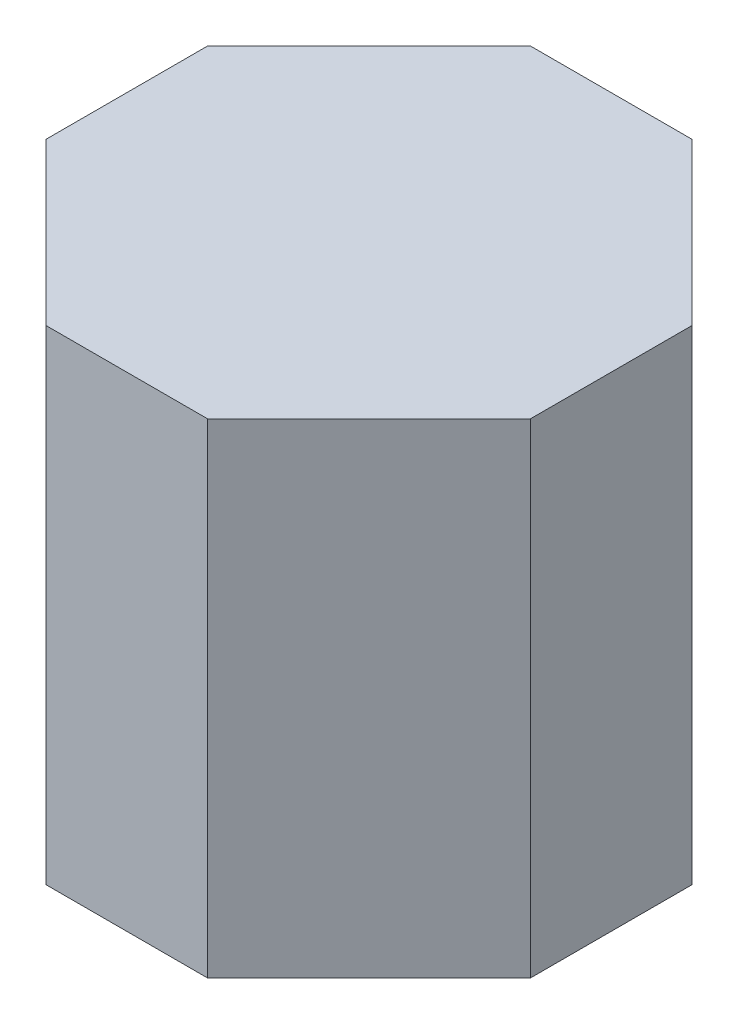
from build123d import *

# Parameters (mm, degrees)
ESQUISSE1_W             = 30
ESQUISSE1_H             = 30
BOSS_EXTRU_1_DEPTH      = 30
ENL_V_MAT_EXTRU_1_REACH = 47
ENL_V_MAT_EXTRU_2_REACH = 41.843
ESQUISSE4_R             = 3.25
ESQUISSE6_R             = 2.75
ENL_V_MAT_EXTRU_3_DEPTH = 10


with BuildPart() as part:
    # Esquisse1 → Boss.-Extru.1 (new body)
    with BuildSketch(Plane.XY):
        Rectangle(ESQUISSE1_W, ESQUISSE1_H)
    extrude(amount=BOSS_EXTRU_1_DEPTH)

    # Esquisse3 → Enlèv. mat.-Extru.1 (cut, up to next)
    with BuildSketch(Plane(origin=(0, 15, 0), x_dir=(1, 0, 0), z_dir=(0, 1, 0)), mode=Mode.PRIVATE) as enl_v_mat_extru_1_sk1:
        Polygon((-15, -20), (-5, -30), (-15, -30), align=None)
    enl_v_mat_extru_1_tool1 = extrude(enl_v_mat_extru_1_sk1.sketch, amount=-ENL_V_MAT_EXTRU_1_REACH, mode=Mode.PRIVATE) & part.part
    # Esquisse3 → Enlèv. mat.-Extru.1 (cut, up to next)
    with BuildSketch(Plane(origin=(0, 15, 0), x_dir=(1, 0, 0), z_dir=(0, 1, 0)), mode=Mode.PRIVATE) as enl_v_mat_extru_1_sk2:
        Polygon((-15, 0), (-15, -10), (-5, 0), align=None)
    enl_v_mat_extru_1_tool2 = extrude(enl_v_mat_extru_1_sk2.sketch, amount=-ENL_V_MAT_EXTRU_1_REACH, mode=Mode.PRIVATE) & part.part
    # Esquisse3 → Enlèv. mat.-Extru.1 (cut, up to next)
    with BuildSketch(Plane(origin=(0, 15, 0), x_dir=(1, 0, 0), z_dir=(0, 1, 0)), mode=Mode.PRIVATE) as enl_v_mat_extru_1_sk3:
        Polygon((15, 0), (5, 0), (15, -10), align=None)
    enl_v_mat_extru_1_tool3 = extrude(enl_v_mat_extru_1_sk3.sketch, amount=-ENL_V_MAT_EXTRU_1_REACH, mode=Mode.PRIVATE) & part.part
    # Esquisse3 → Enlèv. mat.-Extru.1 (cut, up to next)
    with BuildSketch(Plane(origin=(0, 15, 0), x_dir=(1, 0, 0), z_dir=(0, 1, 0)), mode=Mode.PRIVATE) as enl_v_mat_extru_1_sk4:
        Polygon((15, -30), (15, -20), (5, -30), align=None)
    enl_v_mat_extru_1_tool4 = extrude(enl_v_mat_extru_1_sk4.sketch, amount=-ENL_V_MAT_EXTRU_1_REACH, mode=Mode.PRIVATE) & part.part
    add(enl_v_mat_extru_1_tool1.solids().sort_by_distance((-11.666667, 15, 26.666667))[0], mode=Mode.SUBTRACT)
    add(enl_v_mat_extru_1_tool2.solids().sort_by_distance((-11.666667, 15, 3.333333))[0], mode=Mode.SUBTRACT)
    add(enl_v_mat_extru_1_tool3.solids().sort_by_distance((11.666667, 15, 3.333333))[0], mode=Mode.SUBTRACT)
    add(enl_v_mat_extru_1_tool4.solids().sort_by_distance((11.666667, 15, 26.666667))[0], mode=Mode.SUBTRACT)

    # Esquisse4 → Enlèv. mat.-Extru.2 (cut, up to next)
    with BuildSketch(Plane(origin=(-17.5, 0, 17.5), x_dir=(0.7071067811865489, 0, 0.7071067811865462), z_dir=(-0.7071067811865462, 0, 0.7071067811865489)), mode=Mode.PRIVATE) as enl_v_mat_extru_2_sk1:
        with Locations((10.605533906, -5)):
            Circle(ESQUISSE4_R)
    enl_v_mat_extru_2_tool1 = extrude(enl_v_mat_extru_2_sk1.sketch, amount=-ENL_V_MAT_EXTRU_2_REACH, mode=Mode.PRIVATE) & part.part
    add(enl_v_mat_extru_2_tool1.solids().sort_by_distance((-10.000755, -5, 24.999245))[0], mode=Mode.SUBTRACT)

    # Esquisse6 → Enlèv. mat.-Extru.3 (cut)
    with BuildSketch(Plane.XZ.offset(15)):
        with Locations((0, 15)):
            Circle(ESQUISSE6_R)
    extrude(amount=-ENL_V_MAT_EXTRU_3_DEPTH, mode=Mode.SUBTRACT)


solid = part.part
